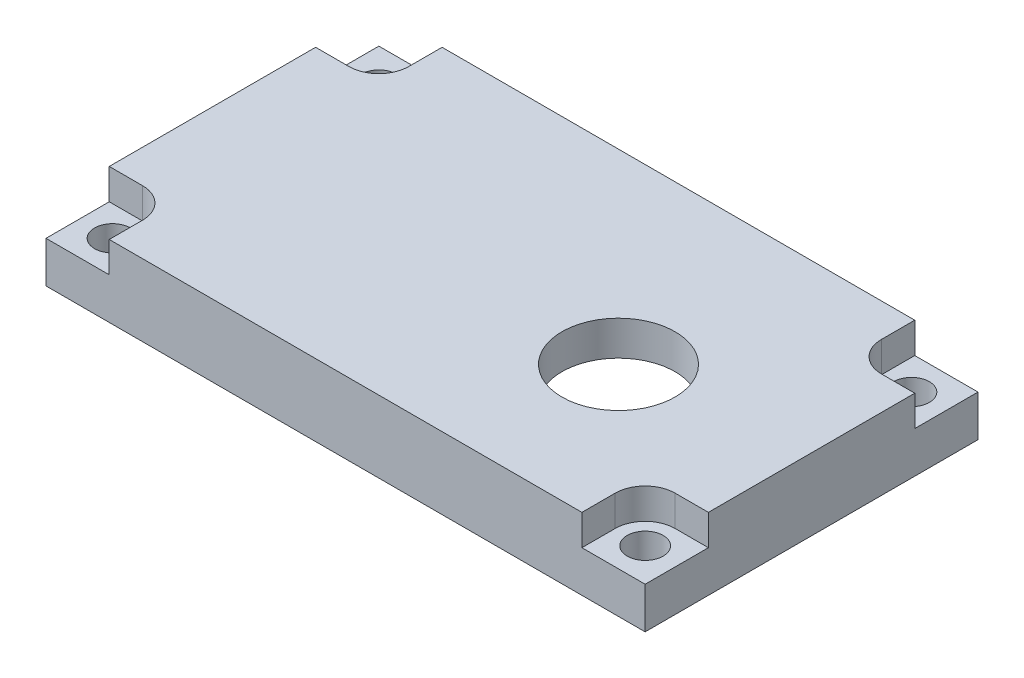
from build123d import *

# Parameters (mm, degrees)
SKETCH_1_W            = 45
SKETCH_1_H            = 25
EXTRUDE_1_DEPTH       = 5.4
SKETCH_2_R            = 1.35
CUT_EXTRUDE_1_DEPTH   = 27.299429652
CUT_EXTRUDE_2_DEPTH   = 2.3
MIRROR_2_COPY_1_DEPTH = 2.3
SHELL_1_DEPTH         = 3.9
SHELL_1_2_DEPTH       = 1.6
SKETCH_4_R            = 4.25
CUT_EXTRUDE_3_DEPTH   = 27.299429652
SKETCH_6_R            = 5.75
SKETCH_6_R_2          = 4.25
EXTRUDE_3_DEPTH       = 1.1
SKETCH_7_R            = 2.25
SKETCH_7_R_2          = 1.25
EXTRUDE_4_DEPTH       = 0.6


# Read off the part's stored shape, not the designer's step: 薄殼1
with BuildPart() as part:
    # 草圖1 → 填料-伸長1 (new body)
    with BuildSketch(Plane(origin=(0, 0, 0), x_dir=(1, 0, 0), z_dir=(0, 1, 0))):
        Rectangle(SKETCH_1_W, SKETCH_1_H)
    extrude(amount=EXTRUDE_1_DEPTH)

    # 草圖2 → 除料-伸長1 (cut, through all)
    with BuildSketch(Plane(origin=(0, 5.4, 0), x_dir=(1, 0, 0), z_dir=(0, 1, 0))):
        with Locations(Location((-20, 10, 0), (0, 0, 270))):
            Circle(SKETCH_2_R)
        with Locations(Location((-20, -10, 0), (0, 0, 270))):
            Circle(SKETCH_2_R)
        with Locations(Location((20, -10, 0), (0, 0, 270))):
            Circle(SKETCH_2_R)
        with Locations(Location((20, 10, 0), (0, 0, 270))):
            Circle(SKETCH_2_R)
    extrude(amount=-CUT_EXTRUDE_1_DEPTH, mode=Mode.SUBTRACT)

    # 草圖3 → 除料-伸長2 (cut)
    with BuildSketch(Plane(origin=(0, 5.4, 0), x_dir=(1, 0, 0), z_dir=(0, 1, 0))):
        with BuildLine():
            Line((-20, -7.75), (-22.5, -7.75))
            Line((-22.5, -7.75), (-22.5, -12.5))
            Line((-22.5, -12.5), (-17.75, -12.5))
            Line((-17.75, -12.5), (-17.75, -10))
            ThreePointArc((-17.75, -10), (-18.409009742, -8.409009742), (-20, -7.75))
        make_face()
    cut_extrude_2 = extrude(amount=-CUT_EXTRUDE_2_DEPTH, mode=Mode.SUBTRACT)

    # 鏡射1: 除料-伸長2 across plane
    add(cut_extrude_2.mirror(Plane.XY), mode=Mode.SUBTRACT)

    # 鏡射2: 除料-伸長2 across plane
    add(cut_extrude_2.mirror(Plane(origin=(0, 0, 0), x_dir=(0, 0, 1), z_dir=(1, 0, 0))), mode=Mode.SUBTRACT)

    # 鏡射2 copy 1 sketch → 鏡射2 copy 1 (cut)
    with BuildSketch(Plane(origin=(0, 5.4, 0), x_dir=(-1, 0, 0), z_dir=(0, 1, 0))):
        with BuildLine():
            Line((-20, -7.75), (-22.5, -7.75))
            Line((-22.5, -7.75), (-22.5, -12.5))
            Line((-22.5, -12.5), (-17.75, -12.5))
            Line((-17.75, -12.5), (-17.75, -10))
            ThreePointArc((-17.75, -10), (-18.409009742, -8.409009742), (-20, -7.75))
        make_face()
    extrude(amount=-MIRROR_2_COPY_1_DEPTH, mode=Mode.SUBTRACT)

    # 薄殼1 outline → 薄殼1 (cut)
    with BuildSketch(Plane(origin=(0, 0, 0), x_dir=(1, 0, 0), z_dir=(0, 1, 0))):
        with BuildLine():
            Line((-16.25, -11), (16.25, -11))
            Line((16.25, -11), (16.25, -10))
            ThreePointArc((16.25, -10), (17.348349571, -7.348349571), (20, -6.25))
            Line((20, -6.25), (21, -6.25))
            Line((21, -6.25), (21, 6.25))
            Line((21, 6.25), (20, 6.25))
            ThreePointArc((20, 6.25), (17.348349571, 7.348349571), (16.25, 10))
            Line((16.25, 10), (16.25, 11))
            Line((16.25, 11), (-16.25, 11))
            Line((-16.25, 11), (-16.25, 10))
            ThreePointArc((-16.25, 10), (-17.348349571, 7.348349571), (-20, 6.25))
            Line((-20, 6.25), (-21, 6.25))
            Line((-21, 6.25), (-21, -6.25))
            Line((-21, -6.25), (-20, -6.25))
            ThreePointArc((-20, -6.25), (-17.348349571, -7.348349571), (-16.25, -10))
            Line((-16.25, -10), (-16.25, -11))
        make_face()
    extrude(amount=SHELL_1_DEPTH, mode=Mode.SUBTRACT)

    # Shell 1 2 outline → Shell 1 2 (cut)
    with BuildSketch(Plane(origin=(0, 0, 0), x_dir=(1, 0, 0), z_dir=(0, 1, 0))):
        with BuildLine():
            Line((16.25, -11), (17.331198771, -11))
            ThreePointArc((17.331198771, -11), (17.984745674, -7.984745674), (21, -7.331198771))
            Line((21, -7.331198771), (21, -6.25))
            Line((21, -6.25), (20, -6.25))
            ThreePointArc((20, -6.25), (17.348349571, -7.348349571), (16.25, -10))
            Line((16.25, -10), (16.25, -11))
        make_face()
        with BuildLine():
            Line((-17.331198771, -11), (-16.25, -11))
            Line((-16.25, -11), (-16.25, -10))
            ThreePointArc((-16.25, -10), (-17.348349571, -7.348349571), (-20, -6.25))
            Line((-20, -6.25), (-21, -6.25))
            Line((-21, -6.25), (-21, -7.331198771))
            ThreePointArc((-21, -7.331198771), (-17.984745674, -7.984745674), (-17.331198771, -11))
        make_face()
        with BuildLine():
            Line((20, 6.25), (21, 6.25))
            Line((21, 6.25), (21, 7.331198771))
            ThreePointArc((21, 7.331198771), (17.984745674, 7.984745674), (17.331198771, 11))
            Line((17.331198771, 11), (16.25, 11))
            Line((16.25, 11), (16.25, 10))
            ThreePointArc((16.25, 10), (17.348349571, 7.348349571), (20, 6.25))
        make_face()
        with BuildLine():
            Line((-21, 7.331198771), (-21, 6.25))
            Line((-21, 6.25), (-20, 6.25))
            ThreePointArc((-20, 6.25), (-17.348349571, 7.348349571), (-16.25, 10))
            Line((-16.25, 10), (-16.25, 11))
            Line((-16.25, 11), (-17.331198771, 11))
            ThreePointArc((-17.331198771, 11), (-17.984745674, 7.984745674), (-21, 7.331198771))
        make_face()
    extrude(amount=SHELL_1_2_DEPTH, mode=Mode.SUBTRACT)

    # 草圖4 → 除料-伸長3 (cut, through all)
    with BuildSketch(Plane(origin=(0, 5.4, 0), x_dir=(1, 0, 0), z_dir=(0, 1, 0))):
        with Locations(Location((9.5, -1.5, 0), (0, 0, 270))):
            Circle(SKETCH_4_R)
    extrude(amount=-CUT_EXTRUDE_3_DEPTH, mode=Mode.SUBTRACT)

    # 草圖6 → 填料-伸長3 (add)
    with BuildSketch(Plane.XZ.offset(-3.9)):
        with Locations(Location((9.5, 1.5, 0), (0, 0, 90))):
            Circle(SKETCH_6_R)
        with Locations(Location((9.5, 1.5, 0), (0, 0, 90))):
            Circle(SKETCH_6_R_2, mode=Mode.SUBTRACT)
    extrude(amount=EXTRUDE_3_DEPTH)

    # 草圖7 → 填料-伸長4 (add)
    with BuildSketch(Plane.XZ.offset(-3.9)):
        with Locations(Location((-9.5, 1.5, 0), (0, 0, 90))):
            Circle(SKETCH_7_R)
        with Locations(Location((-9.5, 1.5, 0), (0, 0, 270))):
            Circle(SKETCH_7_R_2, mode=Mode.SUBTRACT)
    extrude(amount=EXTRUDE_4_DEPTH)


solid = part.part
